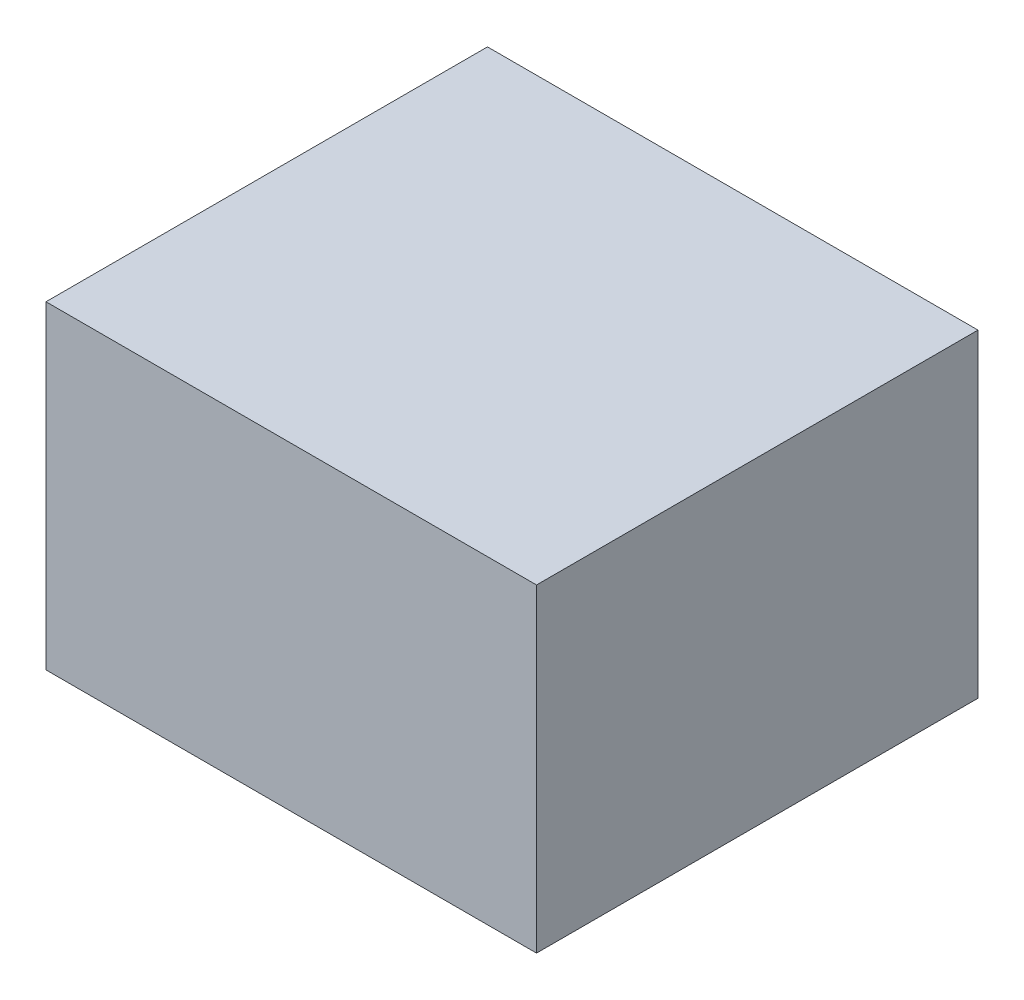
from build123d import *

# Parameters (mm, degrees)
SKETCH1_W           = 200
SKETCH1_H           = 180
BOSS_EXTRUDE1_DEPTH = 130


with BuildPart() as part:
    # Sketch1 → Boss-Extrude1 (new body)
    with BuildSketch(Plane(origin=(0, 0, 0), x_dir=(1, 0, 0), z_dir=(0, 1, 0))):
        Rectangle(SKETCH1_W, SKETCH1_H)
    extrude(amount=BOSS_EXTRUDE1_DEPTH)


solid = part.part
